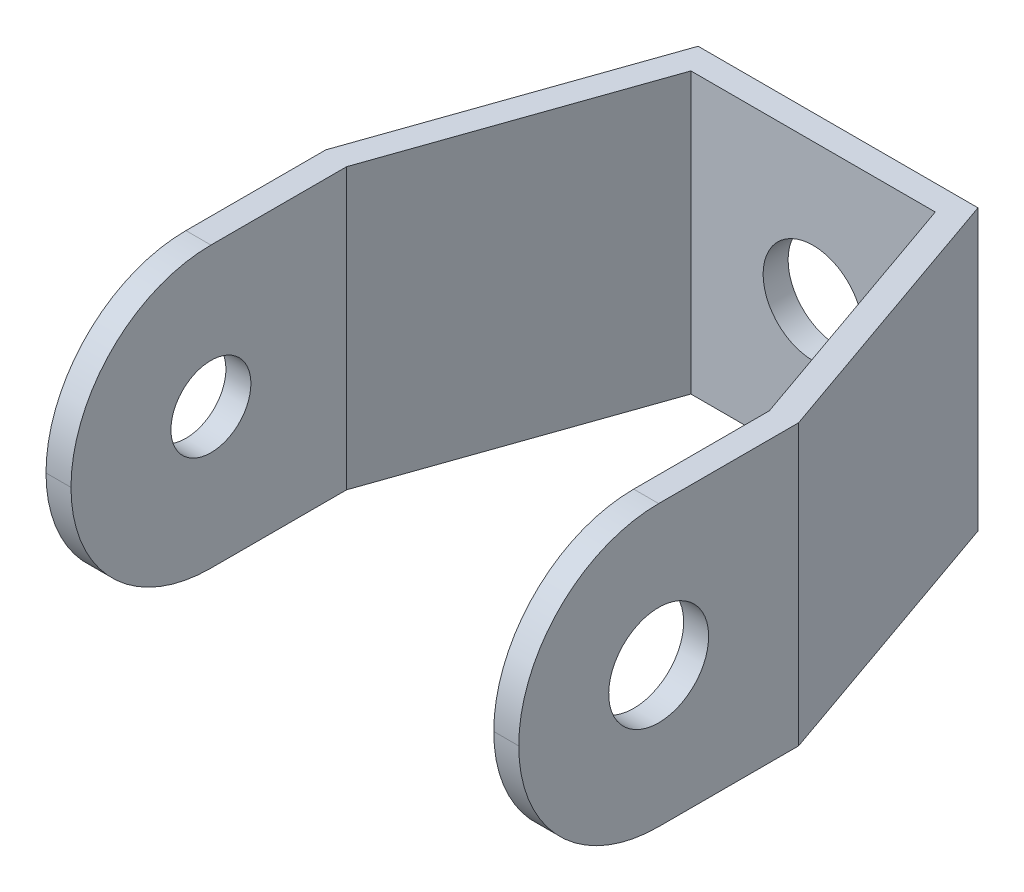
from build123d import *

# Parameters (mm, degrees)
ESBO_O1_W                  = 47.3
ESBO_O1_H                  = 28
RESSALTO_EXTRUS_O1_DEPTH   = 55.6
CORTE_EXTRUS_O1_DEPTH      = 67.593411836
CORTE_EXTRUS_O2_DEPTH      = 67.593411836
CORTE_EXTRUS_O3_DEPTH      = 75.327989345
CORTE_EXTRUS_O3_DEPTH_BACK = 5.6
ESBO_O4_R                  = 5
ESBO_O5_R                  = 4
CORTE_EXTRUS_O6_DEPTH      = 5.6
FILETE1_R                  = 14
FILETE2_R                  = 14
ESBO_O6_R                  = 5
CORTE_EXTRUS_O7_DEPTH      = 5.6


with BuildPart() as part:
    # Esboço1 → Ressalto-extrusão1 (new body)
    with BuildSketch(Plane.XY):
        Rectangle(ESBO_O1_W, ESBO_O1_H)
    extrude(amount=RESSALTO_EXTRUS_O1_DEPTH)

    # Esboço2 → Corte-extrusão1 (cut, through all)
    with BuildSketch(Plane(origin=(0, 14, 0), x_dir=(1, 0, 0), z_dir=(0, 1, 0))):
        Polygon((-23.65, -27.6), (-23.65, 0), (-14, 0), align=None)
        Polygon((14, 0), (23.65, 0), (23.65, -27.6), align=None)
    extrude(amount=-CORTE_EXTRUS_O1_DEPTH, mode=Mode.SUBTRACT)

    # Esboço3 → Corte-extrusão2 (cut, through all)
    with BuildSketch(Plane(origin=(0, 14, 0), x_dir=(1, 0, 0), z_dir=(0, 1, 0))):
        Polygon((-21.15, -28.02444916), (-21.15, -55.6), (21.15, -55.6), (21.15, -28.02444916), (12.225690783, -2.5), (-12.225690783, -2.5), align=None)
    extrude(amount=-CORTE_EXTRUS_O2_DEPTH, mode=Mode.SUBTRACT)

    # Esboço4 → Corte-extrusão3 (cut, two sides: drawn at the far end of the back side and taken through both)
    with BuildSketch(Plane(origin=(23.65, 0, 0), x_dir=(0, 0, -1), z_dir=(1, 0, 0)).offset(-CORTE_EXTRUS_O3_DEPTH_BACK)):
        with Locations(Location((-41.6, 0, 0), (0, 0, 270))):
            Circle(ESBO_O4_R)
    extrude(amount=CORTE_EXTRUS_O3_DEPTH + CORTE_EXTRUS_O3_DEPTH_BACK, mode=Mode.SUBTRACT)

    # Esboço5 → Corte-extrusão6 (cut)
    with BuildSketch(Plane.ZY.offset(23.65)):
        with Locations(Location((41.6, 0, 0), (0, 0, 270))):
            Circle(ESBO_O5_R)
    extrude(amount=-CORTE_EXTRUS_O6_DEPTH, mode=Mode.SUBTRACT)

    # Filete1
    filete1_edges = [part.edges().sort_by_distance(p)[0] for p in [
        (-22.4, -14, 55.6),
        (-22.4, 14, 55.6),
    ]]
    fillet(filete1_edges, radius=FILETE1_R - 0.0001)  # a hair under: the kernel refuses the full size

    # Filete2
    filete2_edges = [part.edges().sort_by_distance(p)[0] for p in [
        (22.4, -14, 55.6),
        (22.4, 14, 55.6),
    ]]
    fillet(filete2_edges, radius=FILETE2_R - 0.0001)  # a hair under: the kernel refuses the full size

    # Esboço6 → Corte-extrusão7 (cut)
    with BuildSketch(Plane(origin=(0, 0, 0), x_dir=(-1, 0, 0), z_dir=(0, 0, -1))):
        Circle(ESBO_O6_R)
    extrude(amount=-CORTE_EXTRUS_O7_DEPTH, mode=Mode.SUBTRACT)


solid = part.part
